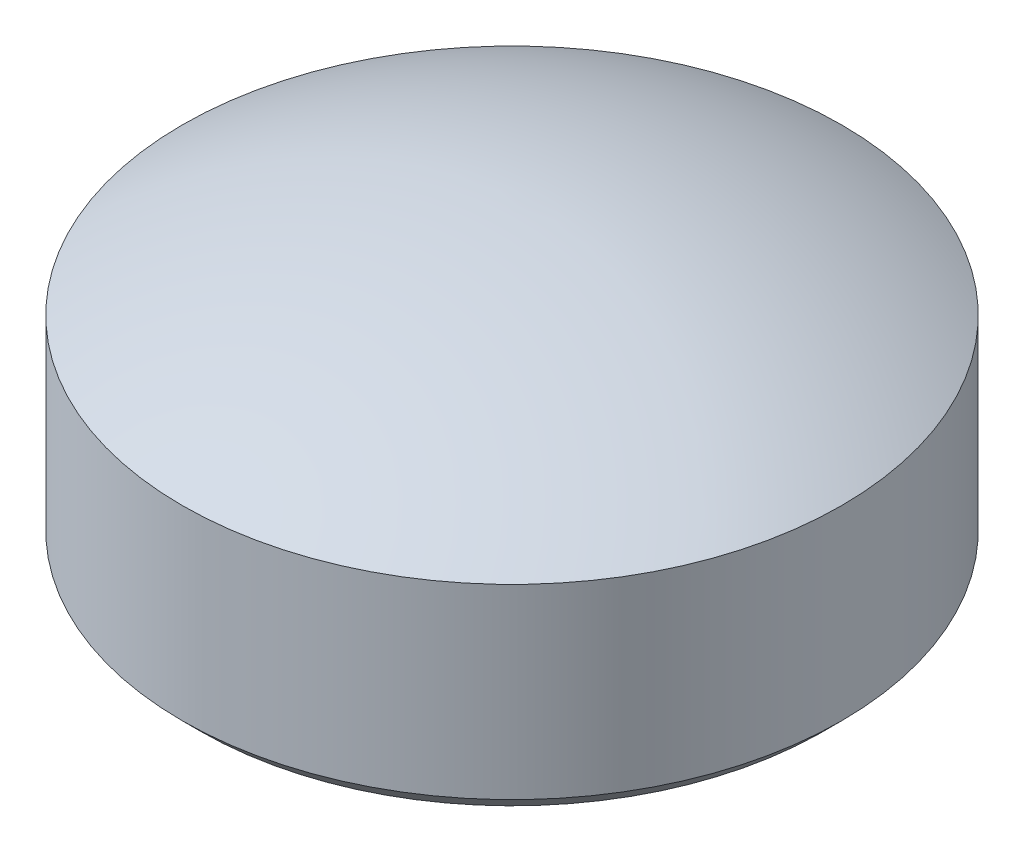
from build123d import *

# Parameters (mm, degrees)
CUT_EXTRUDE1_DEPTH      = 28.349588662
CUT_EXTRUDE1_DEPTH_BACK = 28.349588662
SKETCH2_R               = 18
SKETCH2_R_2             = 9
SKETCH2_5_R             = 9
CUT_EXTRUDE2_DEPTH      = 17.186414056
CHAMFER1_SIZE           = 0.5


with BuildPart() as part:
    # Sketch1 → Revolve1 (revolve)
    with BuildSketch(Plane.XY):
        with BuildLine():
            Line((0, 8), (0, -10))
            Line((0, -10), (-18, -10))
            ThreePointArc((-18, -10), (-12.727922061, 2.727922061), (0, 8))
        make_face()
    revolve(axis=Axis((0, 8, 0), (0, -1, 0)))

    # Sketch2 → Cut-Extrude1 (cut, two sides: drawn at the far end of the back side and taken through both)
    with BuildSketch(Plane(origin=(0, 0, 0), x_dir=(1, 0, 0), z_dir=(0, 1, 0)).offset(-CUT_EXTRUDE1_DEPTH_BACK)):
        Circle(SKETCH2_R)
        Circle(SKETCH2_R_2, mode=Mode.SUBTRACT)
    extrude(amount=CUT_EXTRUDE1_DEPTH + CUT_EXTRUDE1_DEPTH_BACK, mode=Mode.SUBTRACT)

    # Sketch2<5> → Cut-Extrude2 (cut, through all)
    with BuildSketch(Plane(origin=(0, 0, 0), x_dir=(1, 0, 0), z_dir=(0, 1, 0))):
        Circle(SKETCH2_5_R)
    extrude(amount=-CUT_EXTRUDE2_DEPTH, mode=Mode.SUBTRACT)

    # Chamfer1
    chamfer1_edges = [part.edges().sort_by_distance(p)[0] for p in [
        (-9, 0, 0),
    ]]
    chamfer(chamfer1_edges, length=CHAMFER1_SIZE)


solid = part.part
